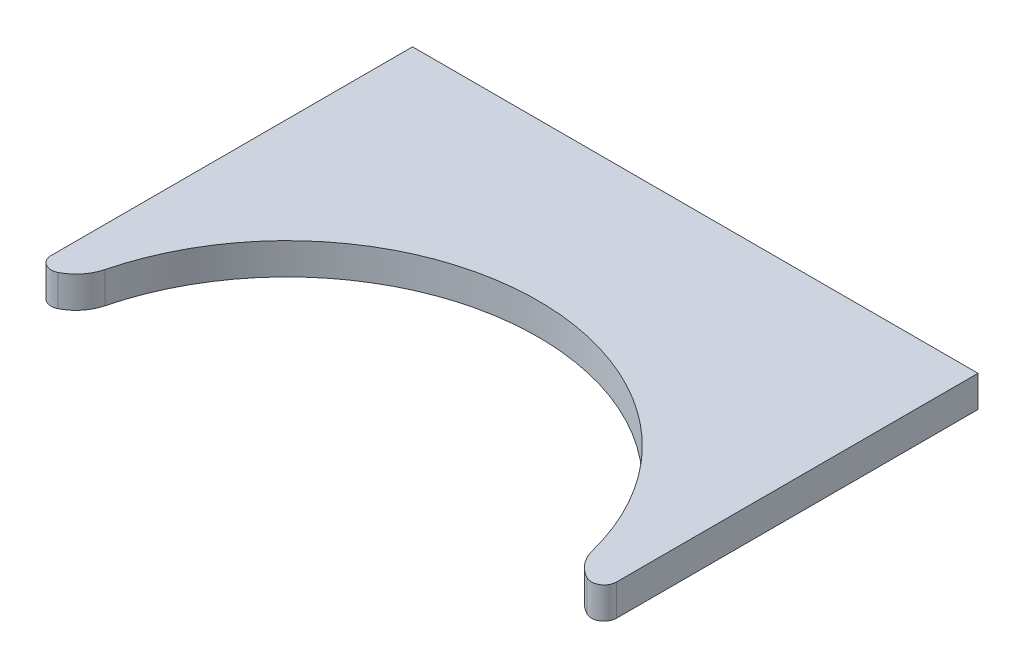
from build123d import *

# Parameters (mm, degrees)
SKETCH1_W           = 57.15
SKETCH1_H           = 38.1
BOSS_EXTRUDE1_DEPTH = 3.175
CUT_EXTRUDE1_DEPTH  = 35.48932806
FILLET3_R           = 1.27


with BuildPart() as part:
    # Sketch1 → Boss-Extrude1 (new body)
    with BuildSketch(Plane(origin=(0, 0, 0), x_dir=(1, 0, 0), z_dir=(0, 1, 0))):
        Rectangle(SKETCH1_W, SKETCH1_H)
    extrude(amount=BOSS_EXTRUDE1_DEPTH)

    # Sketch2 → Cut-Extrude1 (cut, through all)
    with BuildSketch(Plane(origin=(0, 3.175, 0), x_dir=(1, 0, 0), z_dir=(0, 1, 0))):
        with BuildLine():
            Line((-28.575, -19.05), (28.575, -19.05))
            ThreePointArc((28.575, -19.05), (26.06880671, -18.190105659), (24.618461538, -15.972692308))
            ThreePointArc((24.618461538, -15.972692308), (0, 3.175), (-24.618461538, -15.972692308))
            ThreePointArc((-24.618461538, -15.972692308), (-26.06880671, -18.190105659), (-28.575, -19.05))
        make_face()
    extrude(amount=-CUT_EXTRUDE1_DEPTH, mode=Mode.SUBTRACT)

    # Fillet3
    fillet3_edges = [part.edges().sort_by_distance(p)[0] for p in [
        (28.575, 1.5875, 19.05),
        (-28.575, 1.5875, 19.05),
    ]]
    fillet(fillet3_edges, radius=FILLET3_R)


solid = part.part
